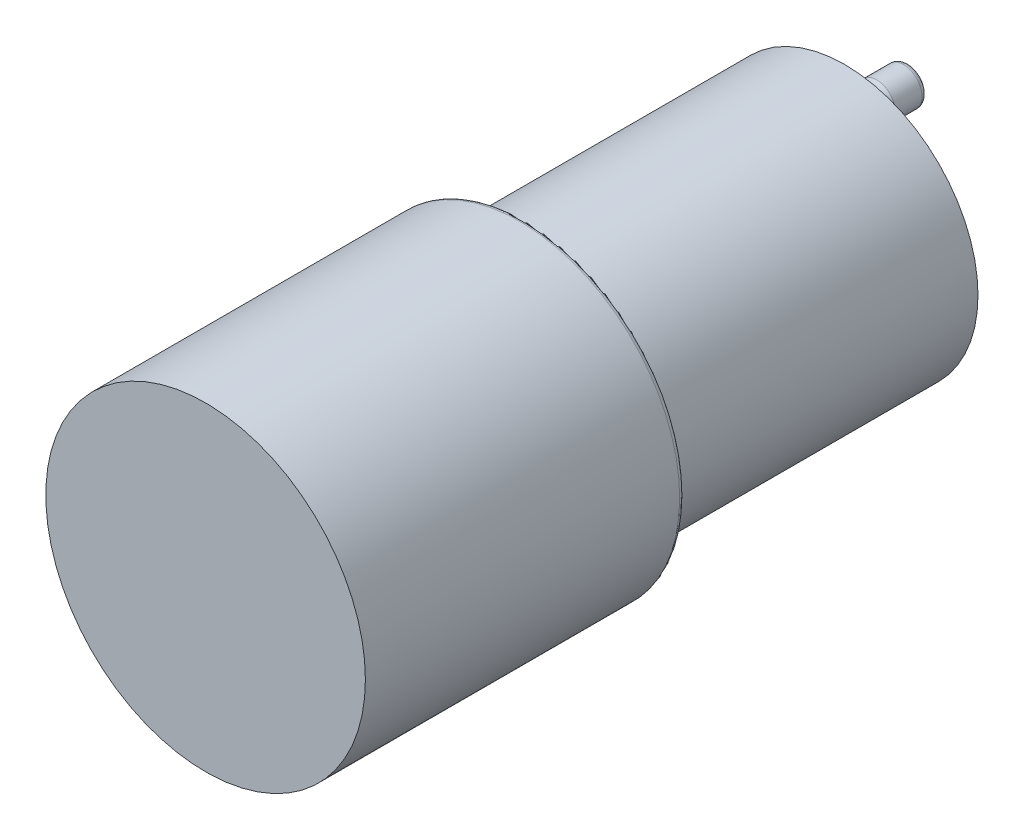
from build123d import *

# Parameters (mm, degrees)
SKETCH_1_R      = 12.5
EXTRUDE_1_DEPTH = 60
SKETCH_3_R      = 1.5
EXTRUDE_2_DEPTH = 3
SKETCH_4_R      = 1.75
EXTRUDE_3_DEPTH = 3
FILLET_1_R      = 10
FILLET_2_R      = 10
FILLET_3_R      = 0.5
SKETCH_5_R      = 15
EXTRUDE_4_DEPTH = 30
FILLET_4_R      = 0.5
FILLET_5_R      = 0.5


with BuildPart() as part:
    # 草图1 → 凸台-拉伸1 (new body)
    with BuildSketch(Plane.XY):
        Circle(SKETCH_1_R)
    extrude(amount=EXTRUDE_1_DEPTH)

    # 草图3 → 凸台-拉伸2 (add)
    with BuildSketch(Plane(origin=(0, 0, 0), x_dir=(-1, 0, 0), z_dir=(0, 0, -1))):
        with Locations(Location((0, 0, 0), (0, 0, 180))):
            Circle(SKETCH_3_R)
        with Locations(Location((0, 8, 0), (0, 0, 180))):
            Circle(SKETCH_3_R)
    extrude(amount=EXTRUDE_2_DEPTH)

    # 草图4 → 凸台-拉伸3 (add)
    with BuildSketch(Plane(origin=(0, 0, -3), x_dir=(-1, 0, 0), z_dir=(0, 0, -1))):
        Circle(SKETCH_4_R)
        with Locations((0, 8)):
            Circle(SKETCH_4_R)
    extrude(amount=EXTRUDE_3_DEPTH)

    # 圆角1
    # the kernel refuses this fillet: 10 mm, written as the material it adds along each edge
    with BuildSketch(Plane(origin=(0, 8, -3), x_dir=(1, 0, 0), z_dir=(0, 1, 0))) as fillet_1_piece_1:
        with BuildLine():
            CenterArc((11.5, -2.222048604), FILLET_1_R, 167.161431859, 12.838568141)
            Line((1.75, 0), (1.5, 0))
            Line((1.5, 0), (1.5, -2.222048604))
        make_face()
    revolve(axis=Axis((0, 8, -3), (0, 0, -1)))

    # 圆角2
    # the kernel refuses this fillet: 10 mm, written as the material it adds along each edge
    with BuildSketch(Plane(origin=(0, 0, -3), x_dir=(1, 0, 0), z_dir=(0, 1, 0))) as fillet_2_piece_1:
        with BuildLine():
            CenterArc((11.5, -2.222048604), FILLET_2_R, 167.161431859, 12.838568141)
            Line((1.75, 0), (1.5, 0))
            Line((1.5, 0), (1.5, -2.222048604))
        make_face()
    revolve(axis=Axis((0, 0, -3), (0, 0, -1)))

    # 圆角3
    fillet_3_edges = [part.edges().sort_by_distance(p)[0] for p in [
        (1.75, 0, -6),
        (1.75, 8, -6),
    ]]
    fillet(fillet_3_edges, radius=FILLET_3_R)

    # 草图5 → 凸台-拉伸4 (add)
    with BuildSketch(Plane.XY.offset(60)):
        Circle(SKETCH_5_R)
    extrude(amount=-EXTRUDE_4_DEPTH)

    # 圆角4
    fillet_4_edges = [part.edges().sort_by_distance(p)[0] for p in [
        (-12.5, 0, 30),
    ]]
    fillet(fillet_4_edges, radius=FILLET_4_R)

    # 圆角5
    fillet_5_edges = [part.edges().sort_by_distance(p)[0] for p in [
        (-15, 0, 30),
    ]]
    fillet(fillet_5_edges, radius=FILLET_5_R)


solid = part.part
